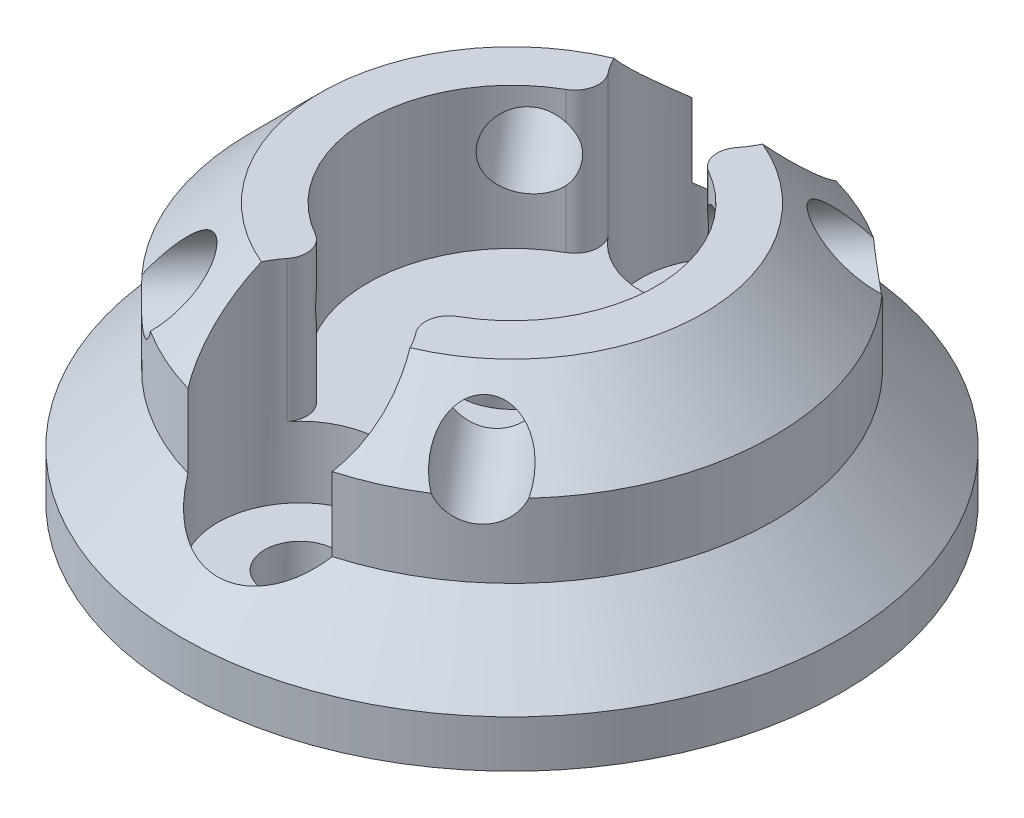
from build123d import *

# Parameters (mm, degrees)
SKETCH1_R           = 14
SKETCH1_R_2         = 2.25
BOSS_EXTRUDE1_DEPTH = 5
SKETCH2_R           = 1.5
CUT_EXTRUDE1_DEPTH  = 21.420577857
SKETCH4_R           = 3.5
CUT_EXTRUDE2_DEPTH  = 3
CIRPATTERN1_COUNT   = 2
SKETCH5_R           = 11.125
SKETCH5_R_2         = 6.125
BOSS_EXTRUDE2_DEPTH = 6
SKETCH6_R           = 3.5
CUT_EXTRUDE3_DEPTH  = 21.688160866
CHAMFER1_SIZE       = 3
FILLET1_START       = 5
FILLET1_DEPTH       = 7
SKETCH8_R           = 1.6
CUT_EXTRUDE4_DEPTH  = 23.649503429
CHAMFER2_SIZE       = 3
CIRPATTERN2_COUNT   = 2
CIRPATTERN2_ANGLE   = 100


with BuildPart() as part:
    # Sketch1 → Boss-Extrude1 (new body)
    with BuildSketch(Plane(origin=(0, 0, 0), x_dir=(1, 0, 0), z_dir=(0, 1, 0))):
        with Locations(Location((0, 0, 0), (0, 0, 270))):
            Circle(SKETCH1_R)
        with Locations(Location((0, 0, 0), (0, 0, 270))):
            Circle(SKETCH1_R_2, mode=Mode.SUBTRACT)
    extrude(amount=BOSS_EXTRUDE1_DEPTH)

    # Sketch2 → Cut-Extrude1 (cut, through all)
    with BuildSketch(Plane(origin=(0, 5, 0), x_dir=(1, 0, 0), z_dir=(0, 1, 0))):
        with Locations(Location((0, 9, 0), (0, 0, 270))):
            Circle(SKETCH2_R)
    cut_extrude1 = extrude(amount=-CUT_EXTRUDE1_DEPTH, mode=Mode.SUBTRACT)

    # Sketch4 → Cut-Extrude2 (cut)
    with BuildSketch(Plane(origin=(0, 5, 0), x_dir=(1, 0, 0), z_dir=(0, 1, 0))):
        with Locations(Location((0, 9, 0), (0, 0, 270))):
            Circle(SKETCH4_R)
    cut_extrude2 = extrude(amount=-CUT_EXTRUDE2_DEPTH, mode=Mode.SUBTRACT)

    # CirPattern1: Cut-Extrude1, Cut-Extrude2 ×2 about axis
    cirpattern1_axis = Axis((0, 0, 0), (0, 1, 0))
    add([cut_extrude1.rotate(cirpattern1_axis, i * 360 / CIRPATTERN1_COUNT) for i in range(1, CIRPATTERN1_COUNT)], mode=Mode.SUBTRACT)
    add([cut_extrude2.rotate(cirpattern1_axis, i * 360 / CIRPATTERN1_COUNT) for i in range(1, CIRPATTERN1_COUNT)], mode=Mode.SUBTRACT)

    # Sketch5 → Boss-Extrude2 (add)
    with BuildSketch(Plane(origin=(0, 5, 0), x_dir=(1, 0, 0), z_dir=(0, 1, 0))):
        with Locations(Location((0, 0, 0), (0, 0, 74.023861397))):
            Circle(SKETCH5_R)
        with Locations(Location((0, 0, 0), (0, 0, 105.450591775))):
            Circle(SKETCH5_R_2, mode=Mode.SUBTRACT)
    extrude(amount=BOSS_EXTRUDE2_DEPTH)

    # Sketch6 → Cut-Extrude3 (cut, through all)
    with BuildSketch(Plane(origin=(0, 5, 0), x_dir=(1, 0, 0), z_dir=(0, 1, 0))):
        with Locations(Location((0, 9, 0), (0, 0, 270))):
            Circle(SKETCH6_R)
        with Locations(Location((0, -9, 0), (0, 0, 331.028467776))):
            Circle(SKETCH6_R)
    extrude(amount=CUT_EXTRUDE3_DEPTH, mode=Mode.SUBTRACT)

    # Chamfer1
    # the kernel refuses this chamfer: 3 mm, written as the material it takes off along each edge
    with BuildSketch(Plane(origin=(0, 5, 0), x_dir=(0, 0, 1), z_dir=(-1, 0, 0))) as chamfer1_piece_1_section:
        Polygon((14, -CHAMFER1_SIZE), (14 - CHAMFER1_SIZE, 0), (14, 0), align=None)
    chamfer1_piece_1 = revolve(axis=Axis((0, 5, 0), (0, 1, 0)), mode=Mode.PRIVATE)
    chamfer1_piece_1 = chamfer1_piece_1 - Plane(origin=(0, 5, 0), x_dir=(0.2752370049355325, 0, -0.9613764044920791), z_dir=(0, -1, 0)) * Cylinder(11.125, 56, mode=Mode.PRIVATE)
    add(chamfer1_piece_1, mode=Mode.SUBTRACT)

    # Fillet1: read off the stored shape, not the designer's step
    # Fillet1 outline → Fillet1 (cut)
    with BuildSketch(Plane(origin=(0, 0, 0), x_dir=(1, 0, 0), z_dir=(0, 1, 0)).offset(FILLET1_START)):
        with BuildLine():
            ThreePointArc((2.73704056, -6.818576389), (2.537172315, -6.005807905), (3.025150093, -5.325794956))
            ThreePointArc((3.025150093, -5.325794956), (2.346304597, -5.65778046), (1.631744733, -5.903645833))
            ThreePointArc((1.631744733, -5.903645833), (2.231780839, -6.303863081), (2.73704056, -6.818576389))
        make_face()
        with BuildLine():
            ThreePointArc((1.631744733, 5.903645833), (2.346304597, 5.65778046), (3.025150093, 5.325794956))
            ThreePointArc((3.025150093, 5.325794956), (2.537172315, 6.005807905), (2.73704056, 6.818576389))
            ThreePointArc((2.73704056, 6.818576389), (2.231780839, 6.303863081), (1.631744733, 5.903645833))
        make_face()
        with BuildLine():
            ThreePointArc((-2.73704056, -6.818576389), (-2.231780839, -6.303863081), (-1.631744733, -5.903645833))
            ThreePointArc((-1.631744733, -5.903645833), (-2.346304597, -5.65778046), (-3.025150093, -5.325794956))
            ThreePointArc((-3.025150093, -5.325794956), (-2.537172315, -6.005807905), (-2.73704056, -6.818576389))
        make_face()
        with BuildLine():
            ThreePointArc((-3.025150093, 5.325794956), (-2.346304597, 5.65778046), (-1.631744733, 5.903645833))
            ThreePointArc((-1.631744733, 5.903645833), (-2.231780839, 6.303863081), (-2.73704056, 6.818576389))
            ThreePointArc((-2.73704056, 6.818576389), (-2.537172315, 6.005807905), (-3.025150093, 5.325794956))
        make_face()
    extrude(amount=FILLET1_DEPTH, mode=Mode.SUBTRACT)

    # Sketch8 → Cut-Extrude4 (cut, symmetric)
    with BuildSketch(Plane(origin=(0, 0, 0), x_dir=(0, -1, 0), z_dir=(-0.6427876096865406, 0, 0.7660444431189771))):
        with Locations(Location((-8.625, 0, 0), (0, 0, 90))):
            Circle(SKETCH8_R)
    cut_extrude4 = extrude(amount=CUT_EXTRUDE4_DEPTH, both=True, mode=Mode.SUBTRACT)

    # Chamfer2
    # the kernel refuses this chamfer: 3 mm, written as the material it takes off along each edge
    with BuildSketch(Plane(origin=(0, 11, 0), x_dir=(-0.4035609850169031, 0, 0.9149527481636345), z_dir=(-0.9149527481636345, 0, -0.4035609850169031))) as chamfer2_piece_1:
        Polygon((11.125, -CHAMFER2_SIZE), (11.125 - CHAMFER2_SIZE, 0), (11.125, 0), align=None)
    revolve(axis=Axis((0, 11, 0), (0, 1, 0)), revolution_arc=227.60196489, mode=Mode.SUBTRACT)
    with BuildSketch(Plane(origin=(0, 11, 0), x_dir=(0.40356098501590637, 0, -0.914952748164074), z_dir=(0.914952748164074, 0, 0.40356098501590637))) as chamfer2_piece_2:
        Polygon((11.125, -CHAMFER2_SIZE), (11.125 - CHAMFER2_SIZE, 0), (11.125, 0), align=None)
    revolve(axis=Axis((0, 11, 0), (0, 1, 0)), revolution_arc=227.60196489, mode=Mode.SUBTRACT)

    # CirPattern2: Cut-Extrude4 ×2 about axis
    cirpattern2_axis = Axis((0, 5, 0), (0, -1, 0))
    for i in range(1, CIRPATTERN2_COUNT):
        add(cut_extrude4.rotate(cirpattern2_axis, i * CIRPATTERN2_ANGLE / (CIRPATTERN2_COUNT - 1)), mode=Mode.SUBTRACT)


solid = part.part
